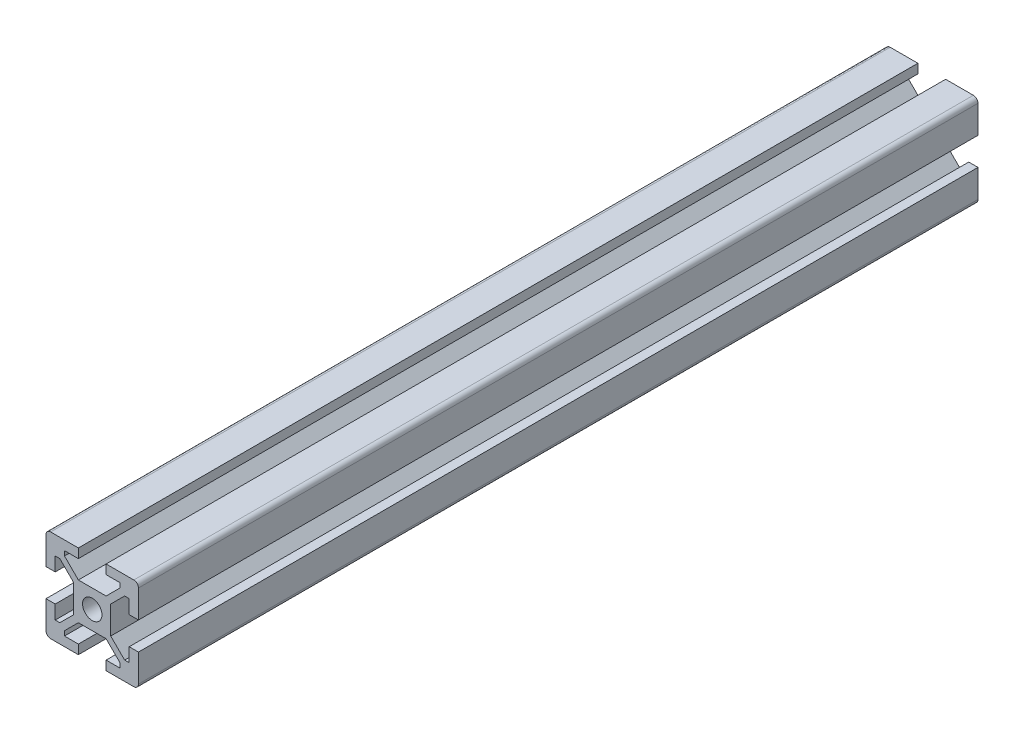
from build123d import *

# Parameters (mm, degrees)
SKETCH1_R           = 2.1
BOSS_EXTRUDE1_DEPTH = 181.575


with BuildPart() as part:
    # Sketch1 → Boss-Extrude1 (new body)
    with BuildSketch(Plane(origin=(0, 0, 0), x_dir=(-1, 0, 0), z_dir=(0, 0, -1))):
        with BuildLine():
            Line((6, -8), (3, -8))
            Line((3, -8), (3, -10))
            Line((3, -10), (9, -10))
            ThreePointArc((9, -10), (9.707106781, -9.707106781), (10, -9))
            Line((10, -9), (10, -3))
            Line((10, -3), (8, -3))
            Line((8, -3), (8, -6))
            Line((8, -6), (7, -6))
            Line((7, -6), (4, -3))
            Line((4, -3), (4, 3))
            Line((4, 3), (7, 6))
            Line((7, 6), (8, 6))
            Line((8, 6), (8, 3))
            Line((8, 3), (10, 3))
            Line((10, 3), (10, 9))
            ThreePointArc((10, 9), (9.707106781, 9.707106781), (9, 10))
            Line((9, 10), (3, 10))
            Line((3, 10), (3, 8))
            Line((3, 8), (6, 8))
            Line((6, 8), (6, 7))
            Line((6, 7), (3, 4))
            Line((3, 4), (-3, 4))
            Line((-3, 4), (-6, 7))
            Line((-6, 7), (-6, 8))
            Line((-6, 8), (-3, 8))
            Line((-3, 8), (-3, 10))
            Line((-3, 10), (-9, 10))
            ThreePointArc((-9, 10), (-9.707106781, 9.707106781), (-10, 9))
            Line((-10, 9), (-10, 3))
            Line((-10, 3), (-8, 3))
            Line((-8, 3), (-8, 6))
            Line((-8, 6), (-7, 6))
            Line((-7, 6), (-4, 3))
            Line((-4, 3), (-4, -3))
            Line((-4, -3), (-7, -6))
            Line((-7, -6), (-8, -6))
            Line((-8, -6), (-8, -3))
            Line((-8, -3), (-10, -3))
            Line((-10, -3), (-10, -9))
            ThreePointArc((-10, -9), (-9.707106781, -9.707106781), (-9, -10))
            Line((-9, -10), (-3, -10))
            Line((-3, -10), (-3, -8))
            Line((-3, -8), (-6, -8))
            Line((-6, -8), (-6, -7))
            Line((-6, -7), (-3, -4))
            Line((-3, -4), (3, -4))
            Line((3, -4), (6, -7))
            Line((6, -7), (6, -8))
        make_face()
        Circle(SKETCH1_R, mode=Mode.SUBTRACT)
    extrude(amount=-BOSS_EXTRUDE1_DEPTH)


solid = part.part
